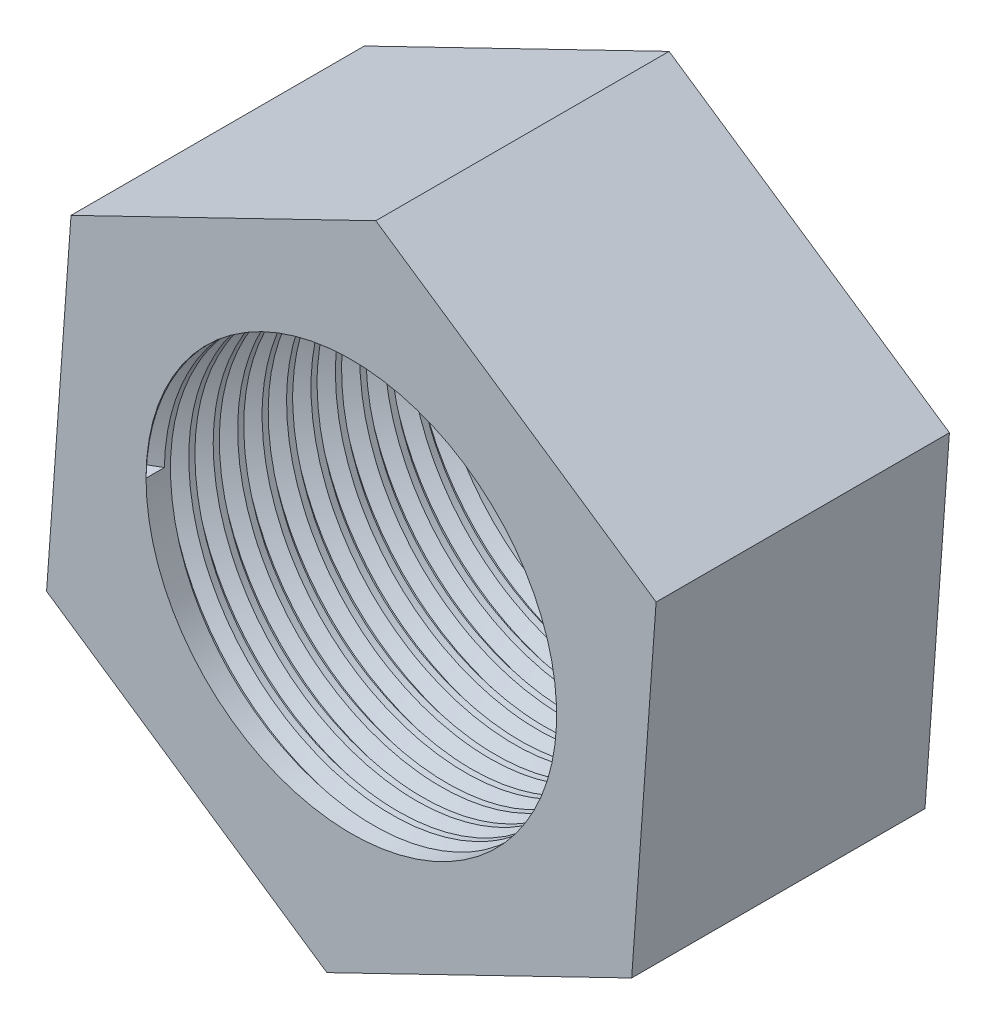
from build123d import *

# Parameters (mm, degrees)
BOSS_EXTRUDE1_DEPTH = 3
SKETCH2_R           = 2.1
CUT_EXTRUDE1_DEPTH  = 6.536639566
THREAD1_PITCH       = 0.25


with BuildPart() as part:
    # Sketch1 → Boss-Extrude1 (new body)
    with BuildSketch(Plane.XY):
        Polygon((-2.867156236, 1.944071789), (-3.117193674, -1.510994242), (-0.250037438, -3.455066031), (2.867156236, -1.944071789), (3.117193674, 1.510994242), (0.250037438, 3.455066031), align=None)
    extrude(amount=BOSS_EXTRUDE1_DEPTH)

    # Sketch2 → Cut-Extrude1 (cut, through all)
    with BuildSketch(Plane.XY.offset(3)):
        Circle(SKETCH2_R)
    extrude(amount=-CUT_EXTRUDE1_DEPTH, mode=Mode.SUBTRACT)

    # Thread1: the profile of Thread Profile1 profile screwed along a right-hand helix of 12 turns, 6 arcs to a turn; built about Z, then put on its axis
    thread1_z = Axis((0, 0, 0), (0, 0, 1))
    thread1_corners = [(2.0997, 0, -0.000173205), (2.235316469, 0, 0.078125), (2.235316469, 0, 0.109375), (2.0997, 0, 0.187673204)]
    with BuildLine(mode=Mode.PRIVATE) as thread1_profile:
        Line(thread1_corners[0], thread1_corners[1])
        Line(thread1_corners[1], thread1_corners[2])
        Line(thread1_corners[2], thread1_corners[3])
        Line(thread1_corners[3], thread1_corners[0])
    thread1_cap = Face(thread1_profile.wire())
    thread1_turn_angles = [0, 30, 60, 90, 120, 150, 180, 210, 240, 270, 300, 330, 360]
    thread1_turn_weights = [1, 0.8660254037844387, 1, 0.8660254037844387, 1, 0.8660254037844387, 1, 0.8660254037844387, 1, 0.8660254037844387, 1, 0.8660254037844387, 1]
    thread1_turn_rails = [Edge.make_bspline([Vector(p[0], p[1], 0).rotate(thread1_z, thread1_turn_angles[k]) / thread1_turn_weights[k] + Vector(0, 0, p[2] + THREAD1_PITCH * thread1_turn_angles[k] / 360) for k in range(13)], [0, 0, 0, 1, 1, 2, 2, 3, 3, 4, 4, 5, 5, 6, 6, 6], 2, thread1_turn_weights) for p in thread1_corners]
    thread1_turn_sides = [Face.make_surface_from_curves(thread1_turn_rails[p[0]], thread1_turn_rails[p[1]]) for p in [(0, 1), (1, 2), (2, 3), (3, 0)]]
    thread1 = Plane(origin=(0, 0, 3), x_dir=(-1, 0, 0), z_dir=(0, 0, -1)) * Solid(Shell([*[p.moved(Location((0, 0, THREAD1_PITCH * i))) for i in range(12) for p in thread1_turn_sides], thread1_cap, thread1_cap.rotate(thread1_z, 4320).moved(Location((0, 0, THREAD1_PITCH * 4320 / 360)))]))
    add(thread1, mode=Mode.SUBTRACT)


solid = part.part
